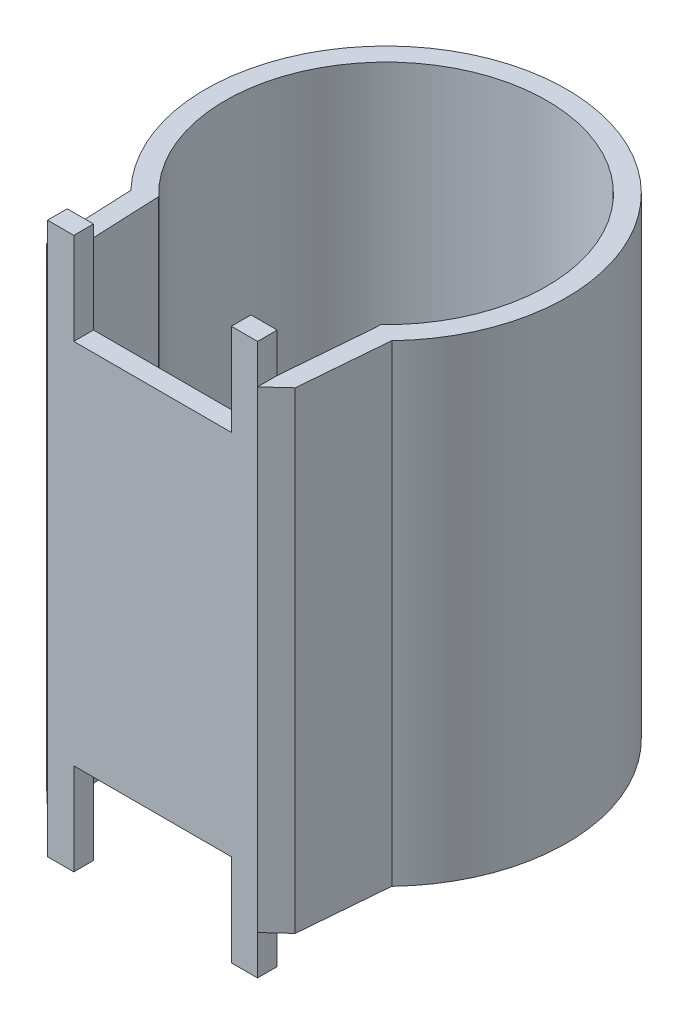
from build123d import *

# Parameters (mm, degrees)
EXTRUDE_1_DEPTH     = 42
CUT_EXTRUDE_START   = -3
CUT_EXTRUDE_3_DEPTH = 3
CUT_EXTRUDE_4_DEPTH = 3
CUT_EXTRUDE_5_DEPTH = 2


# Read off the part's stored shape, not the designer's step: Вырез-Вытянуть3
with BuildPart() as part:
    # Эскиз1 → Бобышка-Вытянуть1 (new body)
    with BuildSketch(Plane(origin=(0, 0, 0), x_dir=(1, 0, 0), z_dir=(0, 1, 0))):
        with BuildLine():
            Line((-8, -0.75), (8, -0.75))
            Line((8, -0.75), (9.494720433, 0.624258888))
            Line((9.494720433, 0.624258888), (10.065554034, 7.409920575))
            ThreePointArc((10.065554034, 7.409920575), (11.957363782, 9.903499319), (13.236218518, 12.760317415))
            ThreePointArc((13.236218518, 12.760317415), (13.878412353, 16.91337864), (13.236218518, 21.066439864))
            ThreePointArc((13.236218518, 21.066439864), (0.128412353, 30.66337864), (-12.979393813, 21.066439864))
            ThreePointArc((-12.979393813, 21.066439864), (-13.621587647, 16.91337864), (-12.979393813, 12.760317415))
            ThreePointArc((-12.979393813, 12.760317415), (-11.695261173, 9.894600658), (-9.794416407, 7.394977019))
            Line((-9.794416407, 7.394977019), (-9.498544352, 0.683933169))
            Line((-9.498544352, 0.683933169), (-8, -0.75))
        make_face()
        with BuildLine():
            Line((8.578412353, 7.625752463), (8, 0.75))
            Line((8, 0.75), (-8, 0.75))
            Line((-8, 0.75), (-8.321587647, 8.04433134))
            ThreePointArc((-8.321587647, 8.04433134), (-10.262087468, 10.424926322), (-11.549451322, 13.21337864))
            ThreePointArc((-11.549451322, 13.21337864), (-12.121587647, 16.91337864), (-11.549451322, 20.61337864))
            ThreePointArc((-11.549451322, 20.61337864), (0.128412353, 29.16337864), (11.806276027, 20.61337864))
            ThreePointArc((11.806276027, 20.61337864), (12.378412353, 16.91337864), (11.806276027, 13.21337864))
            ThreePointArc((11.806276027, 13.21337864), (10.518912173, 10.424926322), (8.578412353, 8.04433134))
            Line((8.578412353, 8.04433134), (8.578412353, 7.625752463))
        make_face(mode=Mode.SUBTRACT)
    extrude(amount=EXTRUDE_1_DEPTH)

    # Вырез-Вытянуть3 outline → Вырез-Вытянуть3 (cut)
    with BuildSketch(Plane(origin=(0, 42, 0), x_dir=(1, 0, 0), z_dir=(0, 1, 0)).offset(CUT_EXTRUDE_START)):
        with BuildLine():
            Line((-9.498544352, 0.683933169), (-8, -0.75))
            Line((-8, -0.75), (-8, 0.75))
            Line((-8, 0.75), (-8.321587647, 8.04433134))
            ThreePointArc((-8.321587647, 8.04433134), (0.128412353, 29.16337864), (8.578412353, 8.04433134))
            Line((8.578412353, 8.04433134), (8.578412353, 7.625752463))
            Line((8.578412353, 7.625752463), (8, 0.75))
            Line((8, 0.75), (8, -0.75))
            Line((8, -0.75), (9.494720433, 0.624258888))
            Line((9.494720433, 0.624258888), (10.065554034, 7.409920575))
            ThreePointArc((10.065554034, 7.409920575), (0.118066222, 30.663374747), (-9.794416407, 7.394977019))
            Line((-9.794416407, 7.394977019), (-9.498544352, 0.683933169))
        make_face()
    extrude(amount=CUT_EXTRUDE_3_DEPTH, mode=Mode.SUBTRACT)

    # Эскиз5 → Вырез-Вытянуть4 (cut)
    with BuildSketch(Plane.XZ):
        Polygon((-15.223121419, -31.649837006), (15.223121419, -31.649837006), (15.223121419, -0.75), (15.223121419, 0.75), (8, 0.75), (8, -0.75), (-8, -0.75), (-8, 0.75), (-15.223121419, 0.75), (-15.223121419, -0.75), align=None)
    extrude(amount=-CUT_EXTRUDE_4_DEPTH, mode=Mode.SUBTRACT)

    # Эскиз2 → Вырез-Вытянуть5 (cut)
    with BuildSketch(Plane.XY.offset(0.75)):
        Polygon((-6, 3), (-6, 0), (6, 0), (6, 3), (6, 7), (-6, 7), align=None)
        Polygon((-6, 39), (-6, 35), (6, 35), (6, 39), (6, 42), (-6, 42), align=None)
    extrude(amount=-CUT_EXTRUDE_5_DEPTH, mode=Mode.SUBTRACT)


solid = part.part
